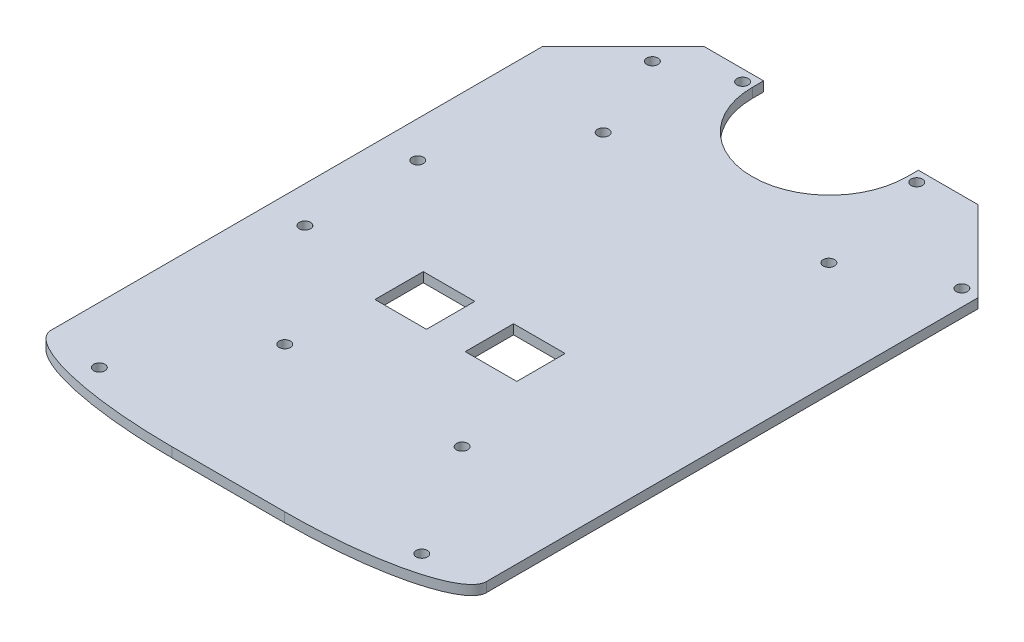
from build123d import *

# Parameters (mm, degrees)
SKETCH2_W           = 135
SKETCH2_H           = 190
BOSS_EXTRUDE2_DEPTH = 3
SKETCH3_R           = 1.75
CUT_EXTRUDE1_DEPTH  = 117.577227622
FILLET1_SIZE        = 12.5
FILLET1_SIZE_2      = 50
FILLET2_SIZE        = 12.5
FILLET2_SIZE_2      = 50
CHAMFER2_SIZE       = 25
CHAMFER3_SIZE       = 25
CUT_EXTRUDE5_DEPTH  = 117.577227764
SKETCH8_R           = 1.75
CUT_EXTRUDE6_DEPTH  = 117.577227764
SKETCH9_R           = 1.75
CUT_EXTRUDE7_DEPTH  = 117.577227764
SKETCH11_R          = 1.75
CUT_EXTRUDE8_DEPTH  = 117.577227764
SKETCH12_W          = 16
SKETCH12_H          = 15
CUT_EXTRUDE9_DEPTH  = 117.577227764


with BuildPart() as part:
    # Sketch2 → Boss-Extrude2 (new body)
    with BuildSketch(Plane(origin=(0, 0, 0), x_dir=(1, 0, 0), z_dir=(0, 1, 0))):
        Rectangle(SKETCH2_W, SKETCH2_H)
    extrude(amount=BOSS_EXTRUDE2_DEPTH)

    # Sketch3 → Cut-Extrude1 (cut, through all)
    with BuildSketch(Plane(origin=(0, 3, 0), x_dir=(1, 0, 0), z_dir=(0, 1, 0))):
        with Locations(Location((-27.5, -50, 0), (0, 0, 270))):
            Circle(SKETCH3_R)
        with Locations(Location((27.5, -50, 0), (0, 0, 90))):
            Circle(SKETCH3_R)
        with Locations(Location((-50, -85, 0), (0, 0, 270))):
            Circle(SKETCH3_R)
        with Locations(Location((50, -85, 0), (0, 0, 90))):
            Circle(SKETCH3_R)
    extrude(amount=-CUT_EXTRUDE1_DEPTH, mode=Mode.SUBTRACT)

    # Fillet1
    # an asymmetric fillet: 50, 12.5 mm, written as the material it takes off along each edge
    with BuildSketch(Plane(origin=(-67.5, -125, 95), x_dir=(0, 0, -1), z_dir=(0, 1, 0))) as fillet1_piece_1:
        with BuildLine():
            Bezier((FILLET1_SIZE, 0), (0, 0), (0, -FILLET1_SIZE_2), weights=[1, 0.707106781, 1])
            Line((0, -FILLET1_SIZE_2), (0, 0))
            Line((0, 0), (FILLET1_SIZE, 0))
        make_face()
    extrude(amount=253, mode=Mode.SUBTRACT)

    # Fillet2
    # an asymmetric fillet: 50, 12.5 mm, written as the material it takes off along each edge
    with BuildSketch(Plane(origin=(67.5, -125, 95), x_dir=(0, 0, -1), z_dir=(0, 1, 0))) as fillet2_piece_1:
        with BuildLine():
            Bezier((FILLET2_SIZE, 0), (0, 0), (0, FILLET2_SIZE_2), weights=[1, 0.707106781, 1])
            Line((0, FILLET2_SIZE_2), (0, 0))
            Line((0, 0), (FILLET2_SIZE, 0))
        make_face()
    extrude(amount=253, mode=Mode.SUBTRACT)

    # Chamfer2
    chamfer2_edges = [part.edges().sort_by_distance(p)[0] for p in [
        (67.5, 1.5, -95),
    ]]
    chamfer(chamfer2_edges, length=CHAMFER2_SIZE)

    # Chamfer3
    chamfer3_edges = [part.edges().sort_by_distance(p)[0] for p in [
        (-67.5, 1.5, -95),
    ]]
    chamfer(chamfer3_edges, length=CHAMFER3_SIZE)

    # Sketch7 → Cut-Extrude5 (cut, through all)
    with BuildSketch(Plane(origin=(0, 3, 0), x_dir=(1, 0, 0), z_dir=(0, 1, 0))):
        with BuildLine():
            Line((24, 91.5), (24, 95))
            Line((24, 95), (-24, 95))
            Line((-24, 95), (-24, 91.5))
            ThreePointArc((-24, 91.5), (0, 67.5), (24, 91.5))
        make_face()
    extrude(amount=-CUT_EXTRUDE5_DEPTH, mode=Mode.SUBTRACT)

    # Sketch8 → Cut-Extrude6 (cut, through all)
    with BuildSketch(Plane(origin=(0, 3, 0), x_dir=(1, 0, 0), z_dir=(0, 1, 0))):
        with Locations(Location((-27, 91.5, 0), (0, 0, 270))):
            Circle(SKETCH8_R)
        with Locations(Location((27, 91.5, 0), (0, 0, 270))):
            Circle(SKETCH8_R)
    extrude(amount=-CUT_EXTRUDE6_DEPTH, mode=Mode.SUBTRACT)

    # Sketch9 → Cut-Extrude7 (cut, through all)
    with BuildSketch(Plane(origin=(0, 3, 0), x_dir=(1, 0, 0), z_dir=(0, 1, 0))):
        with Locations(Location((-56.25, -15, 0), (0, 0, 270))):
            Circle(SKETCH9_R)
        with Locations(Location((-35, 56.25, 0), (0, 0, 270))):
            Circle(SKETCH9_R)
        with Locations(Location((-56.25, 20, 0), (0, 0, 270))):
            Circle(SKETCH9_R)
        with Locations(Location((35, 56.25, 0), (0, 0, 270))):
            Circle(SKETCH9_R)
    extrude(amount=-CUT_EXTRUDE7_DEPTH, mode=Mode.SUBTRACT)

    # Sketch11 → Cut-Extrude8 (cut, through all)
    with BuildSketch(Plane(origin=(0, 3, 0), x_dir=(1, 0, 0), z_dir=(0, 1, 0))):
        with Locations(Location((62.5, 70, 0), (0, 0, 270))):
            Circle(SKETCH11_R)
        with Locations(Location((-46.5, 83, 0), (0, 0, 270))):
            Circle(SKETCH11_R)
    extrude(amount=-CUT_EXTRUDE8_DEPTH, mode=Mode.SUBTRACT)

    # Sketch12 → Cut-Extrude9 (cut, through all)
    with BuildSketch(Plane(origin=(0, 3, 0), x_dir=(1, 0, 0), z_dir=(0, 1, 0))):
        with Locations((-17.534965815, -16.5)):
            Rectangle(SKETCH12_W, SKETCH12_H)
        with Locations((10.465034185, -16.5)):
            Rectangle(SKETCH12_W, SKETCH12_H)
    extrude(amount=-CUT_EXTRUDE9_DEPTH, mode=Mode.SUBTRACT)


solid = part.part
